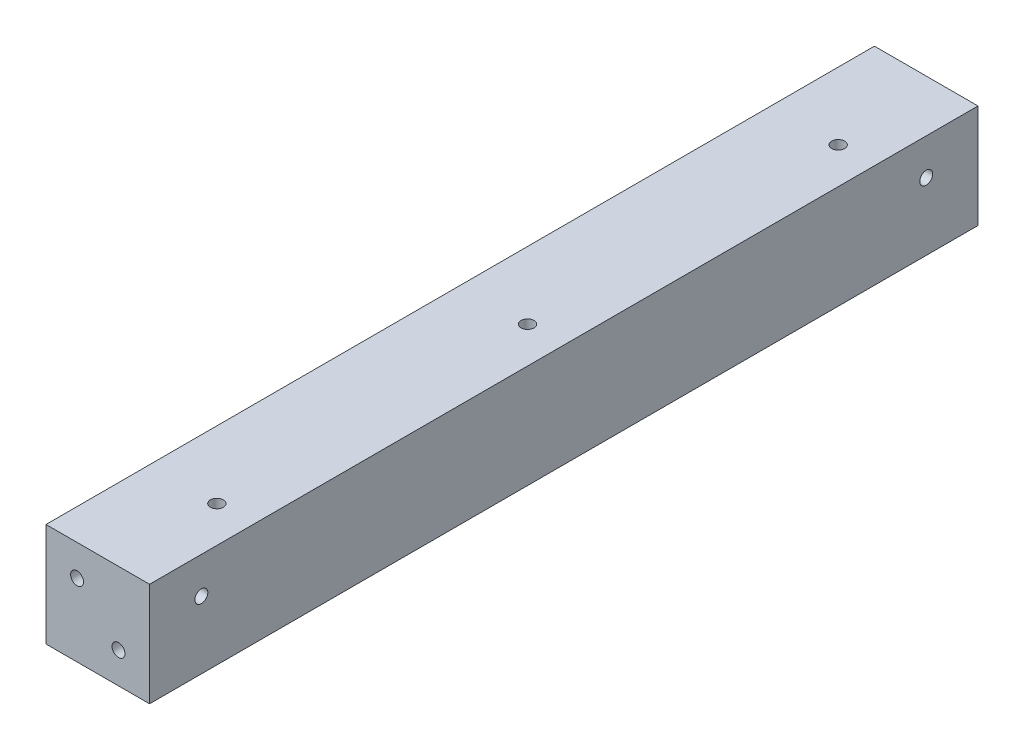
from build123d import *

# Parameters (mm, degrees)
IZIM1_W                     = 20
IZIM1_H                     = 20
Y_KSEKLIK_EKSTR_ZYON1_DEPTH = 160
IZIM13_R                    = 1.25
KES_EKSTR_ZYON1_DEPTH       = 10
KES_EKSTR_ZYON2_START       = -10
IZIM15_R                    = 1.25
KES_EKSTR_ZYON2_DEPTH       = 10
IZIM18_R                    = 1.25
KES_EKSTR_ZYON3_DEPTH       = 10
IZIM20_R                    = 1.25
KES_EKSTR_ZYON4_DEPTH       = 10
SKETCH1_R                   = 1.25
CUT_EXTRUDE1_DEPTH          = 10
SKETCH2_R                   = 1.25
CUT_EXTRUDE2_DEPTH          = 10


with BuildPart() as part:
    # Çizim1 → Yükseklik-Ekstrüzyon1 (new body)
    with BuildSketch(Plane.XY):
        with Locations((10, 10)):
            Rectangle(IZIM1_W, IZIM1_H)
    extrude(amount=Y_KSEKLIK_EKSTR_ZYON1_DEPTH)

    # Çizim13 → Kes-Ekstrüzyon1 (cut)
    with BuildSketch(Plane.XY.offset(160)):
        with Locations((14, 6)):
            Circle(IZIM13_R)
        with Locations((6, 14)):
            Circle(IZIM13_R)
    extrude(amount=-KES_EKSTR_ZYON1_DEPTH, mode=Mode.SUBTRACT)

    # Çizim15 → Kes-Ekstrüzyon2 (cut)
    with BuildSketch(Plane(origin=(0, 0, 0), x_dir=(-1, 0, 0), z_dir=(0, 0, -1)).offset(KES_EKSTR_ZYON2_START)):
        with Locations((-14, 6)):
            Circle(IZIM15_R)
        with Locations((-6, 14)):
            Circle(IZIM15_R)
    extrude(amount=KES_EKSTR_ZYON2_DEPTH, mode=Mode.SUBTRACT)

    # Çizim18 → Kes-Ekstrüzyon3 (cut)
    with BuildSketch(Plane(origin=(20, 0, 0), x_dir=(0, 0, -1), z_dir=(1, 0, 0))):
        with Locations((-10, 13)):
            Circle(IZIM18_R)
        with Locations((-150, 13)):
            Circle(IZIM18_R)
    extrude(amount=-KES_EKSTR_ZYON3_DEPTH, mode=Mode.SUBTRACT)

    # Çizim20 → Kes-Ekstrüzyon4 (cut)
    with BuildSketch(Plane.XZ):
        with Locations((7, 10)):
            Circle(IZIM20_R)
        with Locations((7, 150)):
            Circle(IZIM20_R)
    extrude(amount=-KES_EKSTR_ZYON4_DEPTH, mode=Mode.SUBTRACT)

    # Sketch1 → Cut-Extrude1 (cut)
    with BuildSketch(Plane(origin=(0, 20, 0), x_dir=(1, 0, 0), z_dir=(0, 1, 0))):
        with Locations((13, -20)):
            Circle(SKETCH1_R)
        with Locations((13, -80)):
            Circle(SKETCH1_R)
        with Locations((13, -140)):
            Circle(SKETCH1_R)
    extrude(amount=-CUT_EXTRUDE1_DEPTH, mode=Mode.SUBTRACT)

    # Sketch2 → Cut-Extrude2 (cut)
    with BuildSketch(Plane.ZY):
        with Locations((20, 7)):
            Circle(SKETCH2_R)
        with Locations((80, 7)):
            Circle(SKETCH2_R)
        with Locations((140, 7)):
            Circle(SKETCH2_R)
    extrude(amount=-CUT_EXTRUDE2_DEPTH, mode=Mode.SUBTRACT)


solid = part.part
